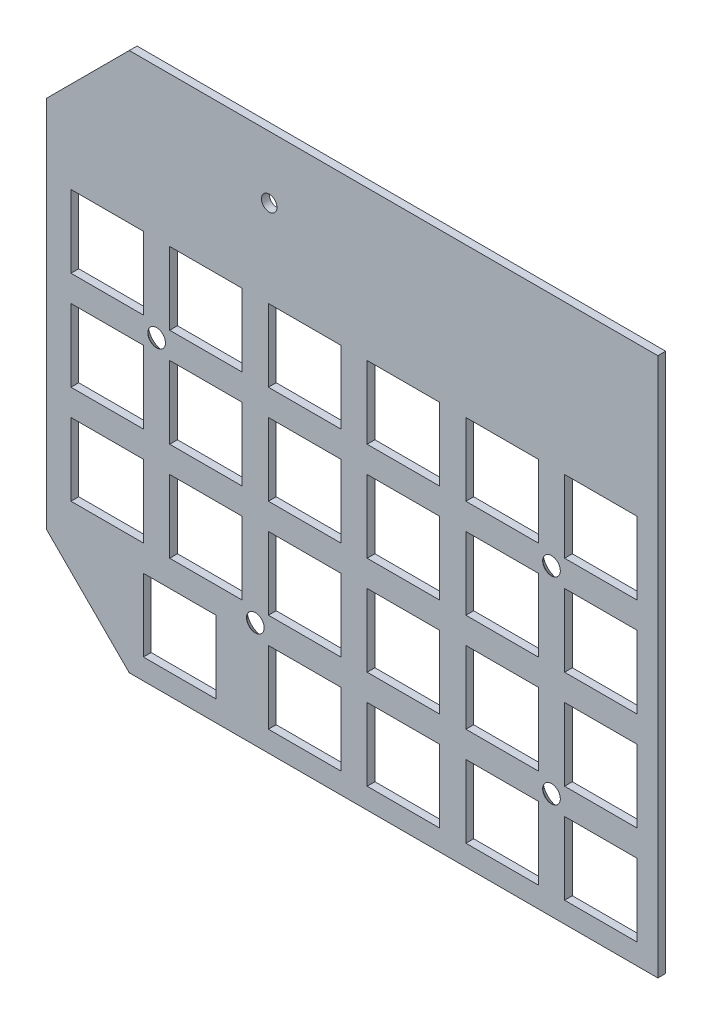
from build123d import *

# Parameters (mm, degrees)
BOSS_EXTRU_1_DEPTH                          = 1.5
ESQUISSE3_R                                 = 1.5
ESQUISSE3_W                                 = 14
ESQUISSE3_H                                 = 14
ENL_V_MAT_EXTRU_2_DEPTH                     = 10
FRAISAGE_POUR_VIS_T_TE_FRAIS_E_M31_AT_COUNT = 2
FRAISAGE_POUR_VIS_T_TE_FRAIS_E_M31_AT_PITCH = 38.1
FRAISAGE_POUR_VIS_T_TE_FRAIS_E_M31_2_COUNT  = 2
FRAISAGE_POUR_VIS_T_TE_FRAIS_E_M31_2_PITCH  = 76.2
FRAISAGE_POUR_VIS_T_TE_FRAIS_E_M31_3_COUNT  = 2
FRAISAGE_POUR_VIS_T_TE_FRAIS_E_M31_3_PITCH  = 68.685751798


with BuildPart() as part:
    # Esquisse1 → Boss.-Extru.1 (new body)
    with BuildSketch(Plane.XY):
        Polygon((0, -85), (16, -101), (118, -101), (118, 3), (16, 3), (0, -13), align=None)
    extrude(amount=BOSS_EXTRU_1_DEPTH)

    # Esquisse3 → Enlèv. mat.-Extru.2 (cut)
    with BuildSketch(Plane(origin=(0, 0, 0), x_dir=(-1, 0, 0), z_dir=(0, 0, -1))):
        with Locations((-43, -9)):
            Circle(ESQUISSE3_R)
        with Locations((-87.95, -32.85)):
            Rectangle(ESQUISSE3_W, ESQUISSE3_H)
        with Locations((-107, -32.85)):
            Rectangle(ESQUISSE3_W, ESQUISSE3_H)
        with Locations((-68.9, -32.85)):
            Rectangle(ESQUISSE3_W, ESQUISSE3_H)
        with Locations((-49.85, -32.85)):
            Rectangle(ESQUISSE3_W, ESQUISSE3_H)
        with Locations((-30.8, -32.85)):
            Rectangle(ESQUISSE3_W, ESQUISSE3_H)
        with Locations((-11.75, -32.85)):
            Rectangle(ESQUISSE3_W, ESQUISSE3_H)
        with Locations((-87.95, -51.9)):
            Rectangle(ESQUISSE3_W, ESQUISSE3_H)
        with Locations((-68.9, -51.9)):
            Rectangle(ESQUISSE3_W, ESQUISSE3_H)
        with Locations((-49.85, -51.9)):
            Rectangle(ESQUISSE3_W, ESQUISSE3_H)
        with Locations((-30.8, -51.9)):
            Rectangle(ESQUISSE3_W, ESQUISSE3_H)
        with Locations((-11.75, -51.9)):
            Rectangle(ESQUISSE3_W, ESQUISSE3_H)
        with Locations((-87.95, -70.95)):
            Rectangle(ESQUISSE3_W, ESQUISSE3_H)
        with Locations((-68.9, -70.95)):
            Rectangle(ESQUISSE3_W, ESQUISSE3_H)
        with Locations((-49.85, -70.95)):
            Rectangle(ESQUISSE3_W, ESQUISSE3_H)
        with Locations((-30.8, -70.95)):
            Rectangle(ESQUISSE3_W, ESQUISSE3_H)
        with Locations((-11.75, -70.95)):
            Rectangle(ESQUISSE3_W, ESQUISSE3_H)
        with Locations((-87.95, -90)):
            Rectangle(ESQUISSE3_W, ESQUISSE3_H)
        with Locations((-68.9, -90)):
            Rectangle(ESQUISSE3_W, ESQUISSE3_H)
        with Locations((-49.85, -90)):
            Rectangle(ESQUISSE3_W, ESQUISSE3_H)
        with Locations((-107, -51.9)):
            Rectangle(ESQUISSE3_W, ESQUISSE3_H)
        with Locations((-107, -70.95)):
            Rectangle(ESQUISSE3_W, ESQUISSE3_H)
        with Locations((-107, -90)):
            Rectangle(ESQUISSE3_W, ESQUISSE3_H)
        with Locations((-25.72, -90)):
            Rectangle(ESQUISSE3_W, ESQUISSE3_H)
    extrude(amount=-ENL_V_MAT_EXTRU_2_DEPTH, mode=Mode.SUBTRACT)

    # Esquisse6 → Fraisage pour vis à tête fraisée M31 (revolve, cut)
    with BuildSketch(Plane(origin=(97.475, -42.375, 0), x_dir=(0, 1, 0), z_dir=(1, 0, 0))):
        Polygon((0, 0), (0, 1.5), (1.7, 1.5), (1.7, 1.45), (3.15, 0), align=None)
    fraisage_pour_vis_t_te_frais_e_m31 = revolve(axis=Axis((97.475, -42.375, -6.35), (0, 0, 1)), mode=Mode.SUBTRACT)

    # Fraisage pour vis à tête fraisée M31 at: Fraisage pour vis à tête fraisée M31 ×2
    with Locations(*[(0, -i * FRAISAGE_POUR_VIS_T_TE_FRAIS_E_M31_AT_PITCH, 0) for i in range(1, FRAISAGE_POUR_VIS_T_TE_FRAIS_E_M31_AT_COUNT)]):
        add(fraisage_pour_vis_t_te_frais_e_m31, mode=Mode.SUBTRACT)

    # Fraisage pour vis _ t_te frais_e M31 2: Fraisage pour vis à tête fraisée M31 ×2
    with Locations(*[(-i * FRAISAGE_POUR_VIS_T_TE_FRAIS_E_M31_2_PITCH, 0, 0) for i in range(1, FRAISAGE_POUR_VIS_T_TE_FRAIS_E_M31_2_COUNT)]):
        add(fraisage_pour_vis_t_te_frais_e_m31, mode=Mode.SUBTRACT)

    # Fraisage pour vis _ t_te frais_e M31 3: Fraisage pour vis à tête fraisée M31 ×2
    with Locations(*[Vector(-0.8320502943378439, -0.5547001962252289, 0) * (i * FRAISAGE_POUR_VIS_T_TE_FRAIS_E_M31_3_PITCH) for i in range(1, FRAISAGE_POUR_VIS_T_TE_FRAIS_E_M31_3_COUNT)]):
        add(fraisage_pour_vis_t_te_frais_e_m31, mode=Mode.SUBTRACT)


solid = part.part
